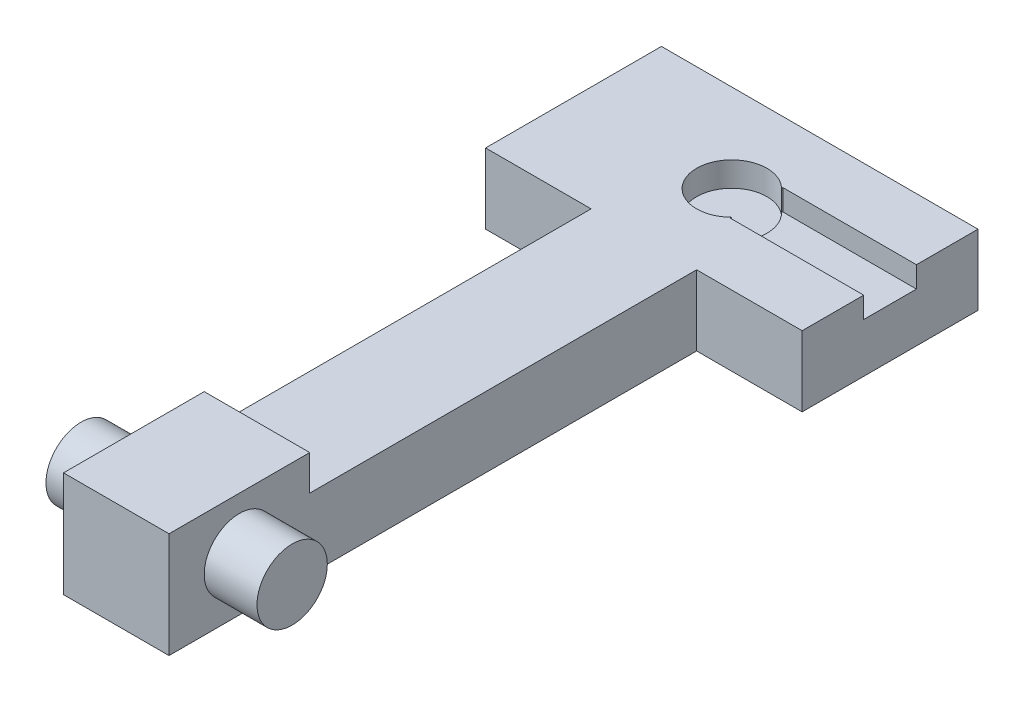
from build123d import *

# Parameters (mm, degrees)
BOSS_EXTRUDE1_DEPTH      = 20
SKETCH2_R                = 10
CUT_EXTRUDE1_DEPTH       = 7
SKETCH3_W                = 38
SKETCH3_H                = 15
CUT_EXTRUDE2_DEPTH       = 6
SKETCH7_W                = 30
SKETCH7_H                = 40
BOSS_EXTRUDE2_DEPTH      = 10
BOSS_EXTRUDE3_DEPTH      = 15
BOSS_EXTRUDE3_DEPTH_BACK = 45
SKETCH8_R                = 10


with BuildPart() as part:
    # Sketch1 → Boss-Extrude1 (new body)
    with BuildSketch(Plane(origin=(0, 0, 0), x_dir=(1, 0, 0), z_dir=(0, 1, 0))):
        Polygon((0, 0), (30, 0), (30, 150), (60, 150), (60, 200), (-30, 200), (-30, 150), (0, 150), align=None)
    extrude(amount=BOSS_EXTRUDE1_DEPTH)

    # Sketch2 → Cut-Extrude1 (cut)
    with BuildSketch(Plane(origin=(0, 20, 0), x_dir=(1, 0, 0), z_dir=(0, 1, 0))):
        with Locations((15, 175)):
            Circle(SKETCH2_R)
    extrude(amount=-CUT_EXTRUDE1_DEPTH, mode=Mode.SUBTRACT)

    # Sketch3 → Cut-Extrude2 (cut)
    with BuildSketch(Plane(origin=(0, 20, 0), x_dir=(1, 0, 0), z_dir=(0, 1, 0))):
        with Locations((41, 175)):
            Rectangle(SKETCH3_W, SKETCH3_H)
    extrude(amount=-CUT_EXTRUDE2_DEPTH, mode=Mode.SUBTRACT)

    # Sketch7 → Boss-Extrude2 (add)
    with BuildSketch(Plane(origin=(0, 20, 0), x_dir=(1, 0, 0), z_dir=(0, 1, 0))):
        with Locations((15, 20)):
            Rectangle(SKETCH7_W, SKETCH7_H)
    extrude(amount=BOSS_EXTRUDE2_DEPTH)

    # Sketch8 → Boss-Extrude3 (add, two sides: drawn at the far end of the back side and taken through both)
    with BuildSketch(Plane(origin=(30, 0, 0), x_dir=(0, 0, -1), z_dir=(1, 0, 0)).offset(-BOSS_EXTRUDE3_DEPTH_BACK)):
        with Locations((20, 15)):
            Circle(SKETCH8_R)
    extrude(amount=BOSS_EXTRUDE3_DEPTH + BOSS_EXTRUDE3_DEPTH_BACK)


solid = part.part
